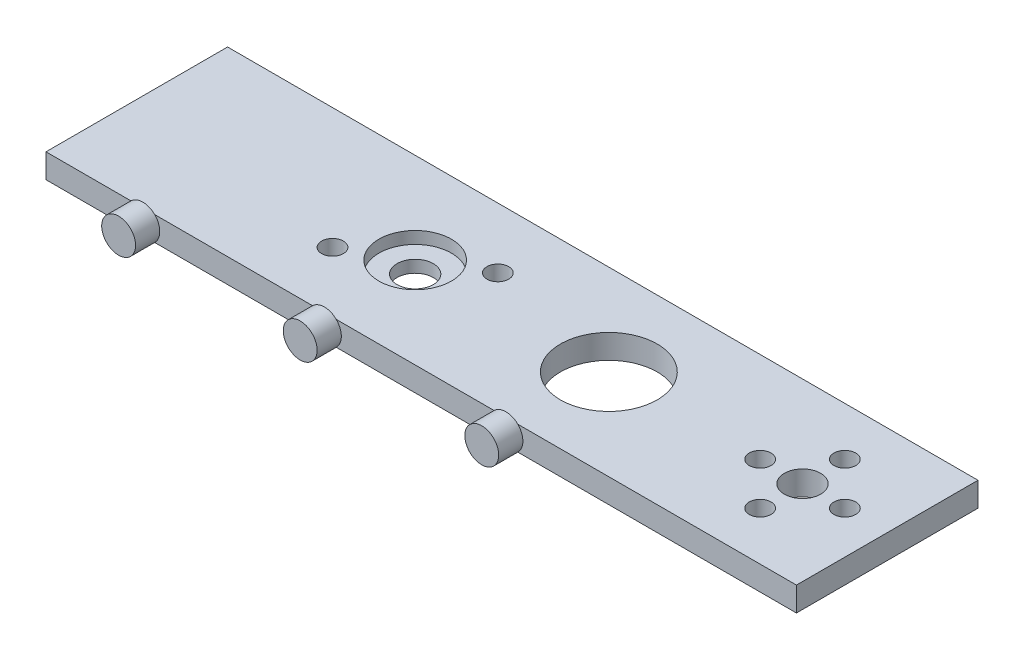
from build123d import *

# Parameters (mm, degrees)
SKETCH_1_W          = 62
SKETCH_1_H          = 15
SKETCH_1_R          = 1.5
SKETCH_1_R_2        = 0.9
SKETCH_1_R_3        = 4
EXTRUDE_1_DEPTH     = 2
SKETCH_2_R          = 1.4
EXTRUDE_2_DEPTH     = 2
SKETCH_4_R          = 3
CUT_EXTRUDE_1_DEPTH = 1


with BuildPart() as part:
    # 草图1 → 凸台-拉伸1 (new body)
    with BuildSketch(Plane(origin=(0, 0, 0), x_dir=(1, 0, 0), z_dir=(0, 1, 0))):
        Rectangle(SKETCH_1_W, SKETCH_1_H)
        with Locations((-8, 0)):
            Circle(SKETCH_1_R, mode=Mode.SUBTRACT)
        with Locations((-3.669872981, 2.5)):
            Circle(SKETCH_1_R_2, mode=Mode.SUBTRACT)
        with Locations((-12.330127019, -2.5)):
            Circle(SKETCH_1_R_2, mode=Mode.SUBTRACT)
        with Locations((8, 0)):
            Circle(SKETCH_1_R_3, mode=Mode.SUBTRACT)
        with Locations((24, 0)):
            Circle(SKETCH_1_R, mode=Mode.SUBTRACT)
        with Locations((27.5, 0)):
            Circle(SKETCH_1_R_2, mode=Mode.SUBTRACT)
        with Locations((24, -3.5)):
            Circle(SKETCH_1_R_2, mode=Mode.SUBTRACT)
        with Locations((20.5, 0)):
            Circle(SKETCH_1_R_2, mode=Mode.SUBTRACT)
        with Locations((24, 3.5)):
            Circle(SKETCH_1_R_2, mode=Mode.SUBTRACT)
    extrude(amount=EXTRUDE_1_DEPTH)

    # 草图2 → 凸台-拉伸2 (add)
    with BuildSketch(Plane.XY.offset(7.5)):
        with Locations((-23, 1)):
            Circle(SKETCH_2_R)
        with Locations((-8, 1)):
            Circle(SKETCH_2_R)
        with Locations((7, 1)):
            Circle(SKETCH_2_R)
    extrude(amount=EXTRUDE_2_DEPTH)

    # 草图4 → 切除-拉伸1 (cut)
    with BuildSketch(Plane(origin=(0, 2, 0), x_dir=(1, 0, 0), z_dir=(0, 1, 0))):
        with Locations((-8, 0)):
            Circle(SKETCH_4_R)
    extrude(amount=-CUT_EXTRUDE_1_DEPTH, mode=Mode.SUBTRACT)


solid = part.part
